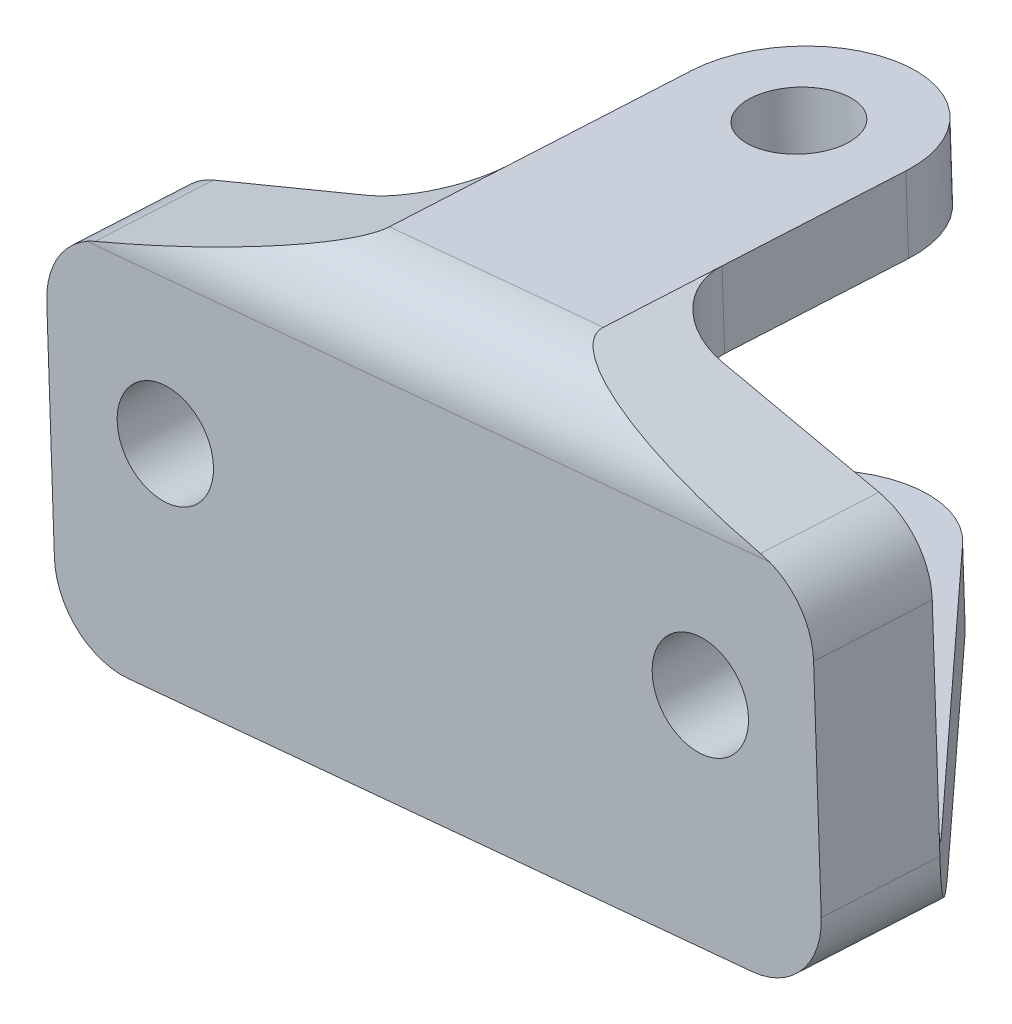
from build123d import *

# Parameters (mm, degrees)
SKETCH_2_R          = 4.050000000000024
EXTRUDE_1_DEPTH     = 50
CUT_EXTRUDE_1_DEPTH = 100
CUT_EXTRUDE_2_DEPTH = 100
SKETCH_7_R          = 4.050000000000008
CUT_EXTRUDE_3_DEPTH = 100
CUT_EXTRUDE_6_DEPTH = 20
CUT_EXTRUDE_7_DEPTH = 20
CUT_EXTRUDE_8_DEPTH = 20
FILLET_1_R          = 6
FILLET_2_R          = 2
FILLET_3_R          = 6
FILLET_4_R          = 6
SKETCH_13_R         = 9.049999999999946
CUT_EXTRUDE_9_DEPTH = 2


with BuildPart() as part:
    # ｽｹｯﾁ2 → ﾎﾞｽ - 押し出し1 (new body)
    with BuildSketch(Plane(origin=(-3.9916e-13, 32.90329120575703, 627.8321969731651), x_dir=(-1, -3e-17, -6.3e-16), z_dir=(0, -0.05233595624294474, -0.9986295347545739))):
        Polygon((-697.0422820628135, 364.8089319187604), (-700.5932035956617, 324.9668567184454), (-636.3478573351539, 319.2409957467275), (-632.7969358023056, 359.08307094704253), align=None)
        with Locations(Location((-644.2839023988065, 340.0275704705168, 0), (0, 0, 90))):
            Circle(SKETCH_2_R, mode=Mode.SUBTRACT)
        with Locations(Location((-689.106236999161, 344.02235719497116, 0), (0, 0, 90))):
            Circle(SKETCH_2_R, mode=Mode.SUBTRACT)
    extrude(amount=EXTRUDE_1_DEPTH)

    # ｽｹｯﾁ5 → ｶｯﾄ - 押し出し1 (cut)
    with BuildSketch(Plane(origin=(723.8064708248907, 64.42078199043551, -3.3761501237952602), x_dir=(-0.004627728743617884, -0.0004118806842991107, -0.9999892071822463), z_dir=(0.9960518800078746, 0.08865137795745748, -0.004646021849131346))):
        Polygon((-608.1434669406992, 296.09511014614947), (-567.6985342683519, 293.98384959158335), (-567.3857549269345, 299.9756914689684), (-597.8442844703076, 301.56565312117255), (-596.645296994875, 324.5343803178144), (-566.186767451502, 322.9444186656103), (-565.8739881100848, 328.9362605429951), (-606.3189207824322, 331.0475210975612), (-626.0453368448235, 332.0772571204365), (-625.4050029902406, 344.3439854408341), (-551.5560275003857, 340.4890048871531), (-554.6576307812425, 281.07230447123857), (-628.5066062710979, 284.92728502491957), (-628.5066062710974, 296.97977053027586), align=None)
    extrude(amount=-CUT_EXTRUDE_1_DEPTH, mode=Mode.SUBTRACT)

    # ｽｹｯﾁ6 → ｶｯﾄ - 押し出し2 (cut)
    with BuildSketch(Plane(origin=(723.8064708248907, 64.42078199043551, -3.3761501237952602), x_dir=(-0.004627728743617884, -0.0004118806842991107, -0.9999892071822463), z_dir=(0.9960518800078746, 0.08865137795745748, -0.004646021849131346))):
        Polygon((-606.3189207824322, 331.04752109756123), (-608.1434669406992, 296.0951101461494), (-619.732969083748, 290.9532658931082), (-617.724208131906, 336.87839675393917), align=None)
    extrude(amount=-CUT_EXTRUDE_2_DEPTH, mode=Mode.SUBTRACT)

    # ｽｹｯﾁ7 → ｶｯﾄ - 押し出し3 (cut)
    with BuildSketch(Plane(origin=(-26.542256166274278, 297.4014749020998, -15.586150855120477), x_dir=(0.9960518800078747, 0.0886513779574575, -0.004646021849131969), z_dir=(-0.0887730383212076, 0.9946868255236824, -0.05212932760779488))):
        with Locations(Location((694.4254727867873, -591.2519877036084, 0), (0, 0, 179.733439165))):
            Circle(SKETCH_7_R)
    extrude(amount=-CUT_EXTRUDE_3_DEPTH, mode=Mode.SUBTRACT)

    # ｽｹｯﾁ8 → ｶｯﾄ - 押し出し6 (cut)
    with BuildSketch(Plane(origin=(-26.542256166274278, 297.4014749020998, -15.586150855120477), x_dir=(0.9960518800078747, 0.0886513779574575, -0.004646021849131969), z_dir=(-0.0887730383212076, 0.9946868255236824, -0.05212932760779488))):
        with BuildLine():
            Line((653.0837968072778, -612.7519877036083), (685.4254727867873, -612.7519877036083))
            Line((685.4254727867873, -612.7519877036083), (685.4254727867873, -591.2626120432828))
            ThreePointArc((685.4254727867873, -591.2626120432828), (694.420160616025, -582.2519830004186), (703.4254727867874, -591.2519877036085))
            Line((703.4254727867874, -591.2519877036085), (703.4254727867874, -612.7519877036083))
            Line((703.4254727867874, -612.7519877036083), (732.6544524188718, -612.7519877036083))
            Line((732.6544524188718, -612.7519877036083), (732.6544524188718, -571.4472878962366))
            Line((732.6544524188718, -571.4472878962366), (653.0837968072778, -571.4472878962366))
            Line((653.0837968072778, -571.4472878962366), (653.0837968072778, -612.7519877036083))
        make_face()
    extrude(amount=-CUT_EXTRUDE_6_DEPTH, mode=Mode.SUBTRACT)

    # ｽｹｯﾁ9 → ｶｯﾄ - 押し出し7 (cut)
    with BuildSketch(Plane(origin=(-23.96783805495928, 268.5555569619133, -14.074400354494276), x_dir=(0.9960518800078746, 0.08865137795745749, -0.0046460218491326), z_dir=(-0.08877303832120763, 0.994686825523682, -0.052129327607802006))):
        with BuildLine():
            Line((701.0201444957777, -585.1274220005872), (726.6754727867866, -612.7519877036101))
            Line((726.6754727867866, -612.7519877036101), (726.6754727867866, -582.25198770361))
            Line((726.6754727867866, -582.25198770361), (694.4254732410474, -582.25198770361))
            ThreePointArc((694.4254732410474, -582.2519877036095), (698.0226182987518, -583.0021062398702), (701.0201444957777, -585.1274220005872))
        make_face()
        with BuildLine():
            ThreePointArc((687.8308010777955, -585.1274220005871), (690.8283276912211, -583.0021060583099), (694.4254732410474, -582.2519877036095))
            Line((694.4254732410474, -582.25198770361), (662.1754727867867, -582.25198770361))
            Line((662.1754727867867, -582.25198770361), (662.1754727867866, -612.7519877036101))
            Line((662.1754727867866, -612.7519877036101), (687.8308010777955, -585.1274220005871))
        make_face()
    extrude(amount=-CUT_EXTRUDE_7_DEPTH, mode=Mode.SUBTRACT)

    # ｽｹｯﾁ10 → ｶｯﾄ - 押し出し8 (cut)
    with BuildSketch(Plane(origin=(-4.2186e-13, 32.06896121623387, 611.9122324003949), x_dir=(-1, -4e-17, -7.1e-16), z_dir=(0, -0.05233595624294566, -0.9986295347545738))):
        Polygon((-674.1060084484338, 360.25482907777223), (-697.885625926865, 355.3464390586851), (-697.2642146586165, 362.31880221874025), align=None)
        Polygon((-656.177074608292, 358.65691438799047), (-633.6427427973452, 349.59294124702217), (-633.0188683981086, 356.5929412470222), align=None)
    extrude(amount=-CUT_EXTRUDE_8_DEPTH, mode=Mode.SUBTRACT)

    # ﾌｨﾚｯﾄ1
    fillet_1_edges = [part.edges().sort_by_distance(p)[0] for p in [
        (700.3712709998582, 359.33885899665444, 599.767605561525),
        (636.1259247393505, 353.62084511839845, 600.0672739707941),
        (697.8856259268646, 387.19009011131783, 598.3079843885063),
        (633.6427427973448, 381.4444772684454, 598.6090991982213),
    ]]
    fillet(fillet_1_edges, radius=FILLET_1_R)

    # ﾌｨﾚｯﾄ2
    # the kernel refuses this fillet: 2 mm, written as the material it adds along each edge
    with BuildSketch(Plane(origin=(699.838632769931, 365.045300168582, 594.461681922105), x_dir=(-0.08877303832120755, 0.9946868255236814, -0.052129327607815884), z_dir=(-0.9960518800078746, -0.08865137795745748, 0.004646021849131346))) as fillet_2_piece_1_section:
        with BuildLine():
            CenterArc((FILLET_2_R, FILLET_2_R), FILLET_2_R, 180.00000000000324, 89.99999999999625)
            Line((2.78e-15, FILLET_2_R), (0, 0))
            Line((0, 0), (FILLET_2_R, 0))
        make_face()
    fillet_2_piece_1 = extrude(amount=64.49999999999983, mode=Mode.PRIVATE)
    fillet_2_piece_1 = split(fillet_2_piece_1, bisect_by=Plane(origin=(684.700257312396, 363.3009068359351, 578.2094916382387), z_dir=(-0.7298483504195092, -0.029343525726524503, 0.6829790208255727)), keep=Keep.TOP, mode=Mode.PRIVATE)
    fillet_2_piece_1 = split(fillet_2_piece_1, bisect_by=Plane(origin=(650.6507062336964, 360.2704024189458, 578.3683136457086), z_dir=(0.7298483504195105, 0.10057352631328549, 0.6761703566371646)), keep=Keep.TOP, mode=Mode.PRIVATE)
    add(fillet_2_piece_1)

    # ﾌｨﾚｯﾄ3
    fillet_3_edges = [part.edges().sort_by_distance(p)[0] for p in [
        (665.1415415283625, 391.55557073207024, 603.0860609736587),
    ]]
    fillet(fillet_3_edges, radius=FILLET_3_R)

    # ﾌｨﾚｯﾄ4
    fillet_4_edges = [part.edges().sort_by_distance(p)[0] for p in [
        (665.6741797582897, 385.06409021649864, 593.4125415917601),
        (656.4433937232551, 387.2502882914526, 593.2979678055787),
        (674.372327563397, 388.84601309468684, 593.2143394122943),
    ]]
    fillet(fillet_4_edges, radius=FILLET_4_R)

    # ｽｹｯﾁ13 → ｶｯﾄ - 押し出し9 (cut)
    with BuildSketch(Plane(origin=(-4.2186e-13, 32.06896121623387, 611.9122324003949), x_dir=(-1, -4e-17, -7e-16), z_dir=(0, -0.05233595624294553, -0.9986295347545739))):
        with Locations(Location((-689.106236999161, 344.02235719497077, 0), (0, 0, 90))):
            Circle(SKETCH_13_R)
        with Locations(Location((-644.2839023988065, 340.02757047051637, 0), (0, 0, 90))):
            Circle(SKETCH_13_R)
    extrude(amount=-CUT_EXTRUDE_9_DEPTH, mode=Mode.SUBTRACT)


solid = part.part
